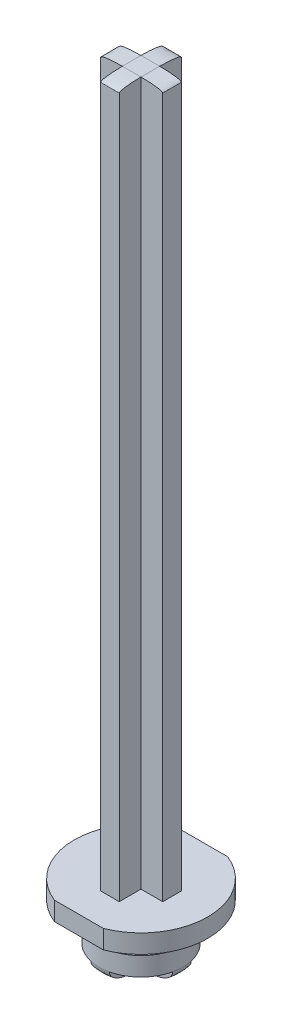
from build123d import *

# Parameters (mm, degrees)
SKETCH1_R           = 4.3
BOSS_EXTRUDE1_DEPTH = 1.2
SKETCH2_W           = 4
SKETCH2_H           = 1.2
SKETCH2_W_2         = 1.2
SKETCH2_H_2         = 4
BOSS_EXTRUDE2_DEPTH = 45.3
SKETCH3_W           = 4
SKETCH3_H           = 1.2
SKETCH3_W_2         = 1.2
SKETCH3_H_2         = 4
BOSS_EXTRUDE3_DEPTH = 1.2
SKETCH4_R           = 2.7
BOSS_EXTRUDE4_DEPTH = 1.2
SKETCH5_W           = 1.2
SKETCH5_H           = 1.2
BOSS_EXTRUDE5_DEPTH = 0.8
FILLET2_SIZE        = 0.2
FILLET2_SIZE_2      = 1.4
FILLET3_SIZE        = 0.8
FILLET3_SIZE_2      = 1.5
SKETCH7_W           = 14
SKETCH7_H           = 1
CUT_EXTRUDE1_DEPTH  = 1.2


with BuildPart() as part:
    # Sketch1 → Boss-Extrude1 (new body)
    with BuildSketch(Plane(origin=(0, 0, 0), x_dir=(1, 0, 0), z_dir=(0, 1, 0))):
        with Locations(Location((0, 0, 0), (0, 0, 270))):
            Circle(SKETCH1_R)
    extrude(amount=BOSS_EXTRUDE1_DEPTH)

    # Sketch2 → Boss-Extrude2 (add)
    with BuildSketch(Plane(origin=(0, 1.2, 0), x_dir=(1, 0, 0), z_dir=(0, 1, 0))):
        Rectangle(SKETCH2_W, SKETCH2_H)
        Rectangle(SKETCH2_W_2, SKETCH2_H_2)
    extrude(amount=BOSS_EXTRUDE2_DEPTH)

    # Sketch3 → Boss-Extrude3 (add)
    with BuildSketch(Plane.XZ):
        Rectangle(SKETCH3_W, SKETCH3_H)
        Rectangle(SKETCH3_W_2, SKETCH3_H_2)
    extrude(amount=BOSS_EXTRUDE3_DEPTH)

    # Sketch4 → Boss-Extrude4 (add)
    with BuildSketch(Plane.XZ.offset(1.2)):
        with Locations(Location((0, 0, 0), (0, 0, 270))):
            Circle(SKETCH4_R)
    extrude(amount=BOSS_EXTRUDE4_DEPTH)

    # Sketch5 → Boss-Extrude5 (add)
    with BuildSketch(Plane.XZ.offset(2.4)):
        with BuildLine():
            Line((0.6, 0.6), (0.6, -0.6))
            Line((0.6, -0.6), (2.632489316, -0.6))
            ThreePointArc((2.632489316, -0.6), (2.683069246, -0.301893066), (2.7, 0))
            ThreePointArc((2.7, 0), (2.683069246, 0.301893066), (2.632489316, 0.6))
            Line((2.632489316, 0.6), (0.6, 0.6))
        make_face()
        with BuildLine():
            Line((-0.6, 0.6), (0.6, 0.6))
            Line((0.6, 0.6), (0.6, 2.632489316))
            ThreePointArc((0.6, 2.632489316), (0.301893068, 2.683069245), (4e-09, 2.7))
            ThreePointArc((4e-09, 2.7), (-0.301893064, 2.683069246), (-0.6, 2.632489316))
            Line((-0.6, 2.632489316), (-0.6, 0.6))
        make_face()
        with BuildLine():
            Line((-2.632489316, -0.6), (-0.6, -0.6))
            Line((-0.6, -0.6), (-0.6, 0.6))
            Line((-0.6, 0.6), (-2.632489316, 0.6))
            ThreePointArc((-2.632489316, 0.6), (-2.683069246, 0.301893066), (-2.7, 0))
            ThreePointArc((-2.7, 0), (-2.683069246, -0.301893066), (-2.632489316, -0.6))
        make_face()
        with BuildLine():
            ThreePointArc((-0.6, -2.632489316), (-0.301893066, -2.683069246), (0, -2.7))
            ThreePointArc((0, -2.7), (0.301893066, -2.683069246), (0.6, -2.632489316))
            Line((0.6, -2.632489316), (0.6, -0.6))
            Line((0.6, -0.6), (-0.6, -0.6))
            Line((-0.6, -0.6), (-0.6, -2.632489316))
        make_face()
        Rectangle(SKETCH5_W, SKETCH5_H)
    extrude(amount=BOSS_EXTRUDE5_DEPTH)

    # Fillet2
    # an asymmetric fillet: 1.4, 0.2 mm, written as the material it takes off along each edge
    with BuildSketch(Plane(origin=(-2, 46.5, 4.1), x_dir=(0, -1, 0), z_dir=(0, 0, -1)), Plane(origin=(4.1, 46.5, 2), x_dir=(0, -1, 0), z_dir=(-1, 0, 0)), Plane(origin=(-4.1, 46.5, -2), x_dir=(0, -1, 0), z_dir=(1, 0, 0)), Plane(origin=(2, 46.5, -4.1), x_dir=(0, -1, 0), z_dir=(0, 0, 1))) as fillet2_piece_1:
        with BuildLine():
            Bezier((FILLET2_SIZE, 0), (0, 0), (0, -FILLET2_SIZE_2), weights=[1, 0.707106781, 1])
            Line((0, -FILLET2_SIZE_2), (0, 0))
            Line((0, 0), (FILLET2_SIZE, 0))
        make_face()
    extrude(amount=8.2, mode=Mode.SUBTRACT)

    # Fillet3
    # an asymmetric fillet: 1.5, 0.8 mm, written as the material it takes off along each edge
    with BuildSketch(Plane(origin=(0, -3.2, 0), x_dir=(0.9991084011597506, 0, 0.0422185117218371), z_dir=(-0.0422185117218371, 0, 0.9991084011597506))) as fillet3_piece_1:
        with BuildLine():
            Bezier((2.7, FILLET3_SIZE), (2.7, 0), (2.7 - FILLET3_SIZE_2, 0), weights=[1, 0.707106781, 1])
            Line((2.7 - FILLET3_SIZE_2, 0), (2.7, 0))
            Line((2.7, 0), (2.7, FILLET3_SIZE))
        make_face()
    revolve(axis=Axis((0, -3.2, 0), (0, 1, 0)), revolution_arc=184.839323409, mode=Mode.SUBTRACT)
    with BuildSketch(Plane(origin=(0, -3.2, 0), x_dir=(-0.999108401159751, 0, -0.04221851172182825), z_dir=(0.04221851172182825, 0, -0.999108401159751))) as fillet3_piece_2:
        with BuildLine():
            Bezier((2.7, FILLET3_SIZE), (2.7, 0), (2.7 - FILLET3_SIZE_2, 0), weights=[1, 0.707106781, 1])
            Line((2.7 - FILLET3_SIZE_2, 0), (2.7, 0))
            Line((2.7, 0), (2.7, FILLET3_SIZE))
        make_face()
    revolve(axis=Axis((0, -3.2, 0), (0, 1, 0)), revolution_arc=184.839323409, mode=Mode.SUBTRACT)
    with BuildSketch(Plane(origin=(0, -3.2, 0), x_dir=(0.042218511721920274, 0, -0.9991084011597471), z_dir=(0.9991084011597471, 0, 0.042218511721920274))) as fillet3_piece_3:
        with BuildLine():
            Bezier((2.7 - FILLET3_SIZE_2, 0), (2.7, 0), (2.7, FILLET3_SIZE), weights=[1, 0.707106781, 1])
            Line((2.7, FILLET3_SIZE), (2.7, 0))
            Line((2.7, 0), (2.7 - FILLET3_SIZE_2, 0))
        make_face()
    revolve(axis=Axis((0, -3.2, 0), (0, 1, 0)), revolution_arc=184.839323409, mode=Mode.SUBTRACT)
    with BuildSketch(Plane(origin=(0, -3.2, 0), x_dir=(-0.0422185117218338, 0, 0.9991084011597507), z_dir=(-0.9991084011597507, 0, -0.0422185117218338))) as fillet3_piece_4:
        with BuildLine():
            Bezier((2.7, FILLET3_SIZE), (2.7, 0), (2.7 - FILLET3_SIZE_2, 0), weights=[1, 0.707106781, 1])
            Line((2.7 - FILLET3_SIZE_2, 0), (2.7, 0))
            Line((2.7, 0), (2.7, FILLET3_SIZE))
        make_face()
    revolve(axis=Axis((0, -3.2, 0), (0, 1, 0)), revolution_arc=184.839323409, mode=Mode.SUBTRACT)

    # Sketch7 → Cut-Extrude1 (cut)
    with BuildSketch(Plane.XZ):
        with Locations((0, 4.5)):
            Rectangle(SKETCH7_W, SKETCH7_H)
        with Locations((0, -4.5)):
            Rectangle(SKETCH7_W, SKETCH7_H)
    extrude(amount=-CUT_EXTRUDE1_DEPTH, mode=Mode.SUBTRACT)


solid = part.part
